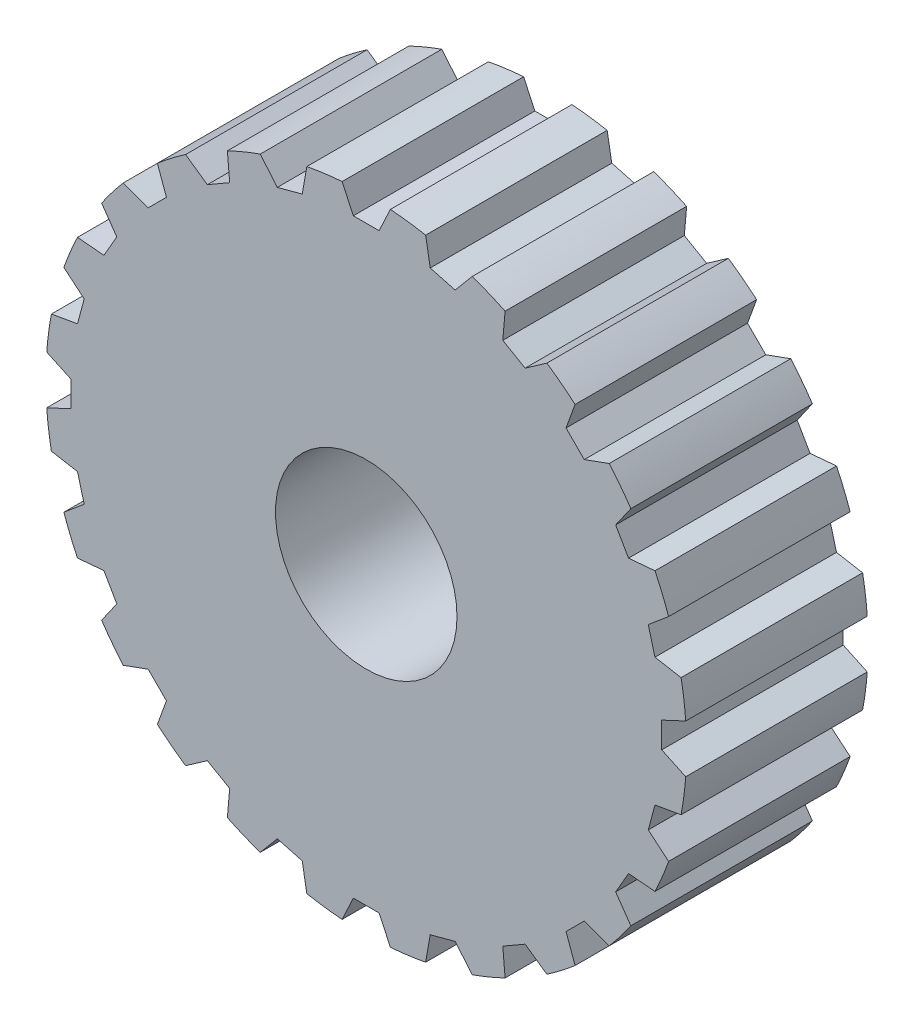
from build123d import *

# Parameters (mm, degrees)
ESQUISSE1_R                  = 14.12
EXTRUSION1_DEPTH             = 8
EXTRUSION2_DEPTH             = 22.511596872
R_P_TITION_CIRCULAIRE1_DEPTH = 8
ESQUISSE3_R                  = 4
EXTRUSION3_DEPTH             = 22.459027804


# Read off the part's stored shape, not the designer's step: Répétition circulaire1
with BuildPart() as part:
    # Esquisse1 → Extrusion1 (new body)
    with BuildSketch(Plane.XY):
        Circle(ESQUISSE1_R)
    extrude(amount=EXTRUSION1_DEPTH)

    # Esquisse2 → Extrusion2 (cut, through all)
    with BuildSketch(Plane.XY.offset(8)):
        Polygon((-0.5685, 13.02), (0.5685, 13.02), (2.149770097, 16.411044667), (-2.149770097, 16.411044667), align=None)
    extrude(amount=-EXTRUSION2_DEPTH, mode=Mode.SUBTRACT)

    # Répétition circulaire1 outline → Répétition circulaire1 (cut)
    with BuildSketch(Plane.XY):
        with BuildLine():
            ThreePointArc((-2.617609549, 13.875248475), (-3.654524917, 13.638872667), (-4.670707871, 13.325122438))
            Line((-4.670707871, 13.325122438), (-3.918952799, 12.429215631))
            Line((-3.918952799, 12.429215631), (-2.820695135, 12.723492885))
            Line((-2.820695135, 12.723492885), (-2.617609549, 13.875248475))
        make_face()
        with BuildLine():
            Line((3.918952799, 12.429215631), (4.670707871, 13.325122438))
            ThreePointArc((4.670707871, 13.325122438), (3.654524917, 13.638872667), (2.617609549, 13.875248475))
            Line((2.617609549, 13.875248475), (2.820695135, 12.723492885))
            Line((2.820695135, 12.723492885), (3.918952799, 12.429215631))
        make_face()
        with BuildLine():
            Line((7.002335442, 10.991400757), (7.960352825, 11.66221175))
            ThreePointArc((7.960352825, 11.66221175), (7.06, 12.228278701), (6.119595228, 12.724973644))
            Line((6.119595228, 12.724973644), (6.017664558, 11.559900757))
            Line((6.017664558, 11.559900757), (7.002335442, 10.991400757))
        make_face()
        with BuildLine():
            Line((9.608520496, 8.804540086), (10.707512889, 9.204540604))
            ThreePointArc((10.707512889, 9.204540604), (9.98434775, 9.98434775), (9.204540604, 10.707512889))
            Line((9.204540604, 10.707512889), (8.804540086, 9.608520496))
            Line((8.804540086, 9.608520496), (9.608520496, 8.804540086))
        make_face()
        with BuildLine():
            Line((11.559900757, 6.017664558), (12.724973644, 6.119595228))
            ThreePointArc((12.724973644, 6.119595228), (12.228278701, 7.06), (11.66221175, 7.960352825))
            Line((11.66221175, 7.960352825), (10.991400757, 7.002335442))
            Line((10.991400757, 7.002335442), (11.559900757, 6.017664558))
        make_face()
        with BuildLine():
            Line((12.723492885, 2.820695135), (13.875248475, 2.617609549))
            ThreePointArc((13.875248475, 2.617609549), (13.638872667, 3.654524917), (13.325122438, 4.670707871))
            Line((13.325122438, 4.670707871), (12.429215631, 3.918952799))
            Line((12.429215631, 3.918952799), (12.723492885, 2.820695135))
        make_face()
        with BuildLine():
            Line((13.02, -0.5685), (14.079948052, -1.062761894))
            ThreePointArc((14.079948052, -1.062761894), (14.12, 0), (14.079948052, 1.062761894))
            Line((14.079948052, 1.062761894), (13.02, 0.5685))
            Line((13.02, 0.5685), (13.02, -0.5685))
        make_face()
        with BuildLine():
            Line((12.429215631, -3.918952799), (13.325122438, -4.670707871))
            ThreePointArc((13.325122438, -4.670707871), (13.638872667, -3.654524917), (13.875248475, -2.617609549))
            Line((13.875248475, -2.617609549), (12.723492885, -2.820695135))
            Line((12.723492885, -2.820695135), (12.429215631, -3.918952799))
        make_face()
        with BuildLine():
            Line((10.991400757, -7.002335442), (11.66221175, -7.960352825))
            ThreePointArc((11.66221175, -7.960352825), (12.228278701, -7.06), (12.724973644, -6.119595228))
            Line((12.724973644, -6.119595228), (11.559900757, -6.017664558))
            Line((11.559900757, -6.017664558), (10.991400757, -7.002335442))
        make_face()
        with BuildLine():
            Line((8.804540086, -9.608520496), (9.204540604, -10.707512889))
            ThreePointArc((9.204540604, -10.707512889), (9.98434775, -9.98434775), (10.707512889, -9.204540604))
            Line((10.707512889, -9.204540604), (9.608520496, -8.804540086))
            Line((9.608520496, -8.804540086), (8.804540086, -9.608520496))
        make_face()
        with BuildLine():
            Line((6.017664558, -11.559900757), (6.119595228, -12.724973644))
            ThreePointArc((6.119595228, -12.724973644), (7.06, -12.228278701), (7.960352825, -11.66221175))
            Line((7.960352825, -11.66221175), (7.002335442, -10.991400757))
            Line((7.002335442, -10.991400757), (6.017664558, -11.559900757))
        make_face()
        with BuildLine():
            Line((2.820695135, -12.723492885), (2.617609549, -13.875248475))
            ThreePointArc((2.617609549, -13.875248475), (3.654524917, -13.638872667), (4.670707871, -13.325122438))
            Line((4.670707871, -13.325122438), (3.918952799, -12.429215631))
            Line((3.918952799, -12.429215631), (2.820695135, -12.723492885))
        make_face()
        with BuildLine():
            Line((-0.5685, -13.02), (-1.062761894, -14.079948052))
            ThreePointArc((-1.062761894, -14.079948052), (0, -14.12), (1.062761894, -14.079948052))
            Line((1.062761894, -14.079948052), (0.5685, -13.02))
            Line((0.5685, -13.02), (-0.5685, -13.02))
        make_face()
        with BuildLine():
            Line((-3.918952799, -12.429215631), (-4.670707871, -13.325122438))
            ThreePointArc((-4.670707871, -13.325122438), (-3.654524917, -13.638872667), (-2.617609549, -13.875248475))
            Line((-2.617609549, -13.875248475), (-2.820695135, -12.723492885))
            Line((-2.820695135, -12.723492885), (-3.918952799, -12.429215631))
        make_face()
        with BuildLine():
            Line((-7.002335442, -10.991400757), (-7.960352825, -11.66221175))
            ThreePointArc((-7.960352825, -11.66221175), (-7.06, -12.228278701), (-6.119595228, -12.724973644))
            Line((-6.119595228, -12.724973644), (-6.017664558, -11.559900757))
            Line((-6.017664558, -11.559900757), (-7.002335442, -10.991400757))
        make_face()
        with BuildLine():
            Line((-9.608520496, -8.804540086), (-10.707512889, -9.204540604))
            ThreePointArc((-10.707512889, -9.204540604), (-9.98434775, -9.98434775), (-9.204540604, -10.707512889))
            Line((-9.204540604, -10.707512889), (-8.804540086, -9.608520496))
            Line((-8.804540086, -9.608520496), (-9.608520496, -8.804540086))
        make_face()
        with BuildLine():
            Line((-11.559900757, -6.017664558), (-12.724973644, -6.119595228))
            ThreePointArc((-12.724973644, -6.119595228), (-12.228278701, -7.06), (-11.66221175, -7.960352825))
            Line((-11.66221175, -7.960352825), (-10.991400757, -7.002335442))
            Line((-10.991400757, -7.002335442), (-11.559900757, -6.017664558))
        make_face()
        with BuildLine():
            Line((-12.723492885, -2.820695135), (-13.875248475, -2.617609549))
            ThreePointArc((-13.875248475, -2.617609549), (-13.638872667, -3.654524917), (-13.325122438, -4.670707871))
            Line((-13.325122438, -4.670707871), (-12.429215631, -3.918952799))
            Line((-12.429215631, -3.918952799), (-12.723492885, -2.820695135))
        make_face()
        with BuildLine():
            Line((-13.02, 0.5685), (-14.079948052, 1.062761894))
            ThreePointArc((-14.079948052, 1.062761894), (-14.12, 0), (-14.079948052, -1.062761894))
            Line((-14.079948052, -1.062761894), (-13.02, -0.5685))
            Line((-13.02, -0.5685), (-13.02, 0.5685))
        make_face()
        with BuildLine():
            Line((-12.429215631, 3.918952799), (-13.325122438, 4.670707871))
            ThreePointArc((-13.325122438, 4.670707871), (-13.638872667, 3.654524917), (-13.875248475, 2.617609549))
            Line((-13.875248475, 2.617609549), (-12.723492885, 2.820695135))
            Line((-12.723492885, 2.820695135), (-12.429215631, 3.918952799))
        make_face()
        with BuildLine():
            Line((-10.991400757, 7.002335442), (-11.66221175, 7.960352825))
            ThreePointArc((-11.66221175, 7.960352825), (-12.228278701, 7.06), (-12.724973644, 6.119595228))
            Line((-12.724973644, 6.119595228), (-11.559900757, 6.017664558))
            Line((-11.559900757, 6.017664558), (-10.991400757, 7.002335442))
        make_face()
        with BuildLine():
            Line((-8.804540086, 9.608520496), (-9.204540604, 10.707512889))
            ThreePointArc((-9.204540604, 10.707512889), (-9.98434775, 9.98434775), (-10.707512889, 9.204540604))
            Line((-10.707512889, 9.204540604), (-9.608520496, 8.804540086))
            Line((-9.608520496, 8.804540086), (-8.804540086, 9.608520496))
        make_face()
        with BuildLine():
            Line((-6.017664558, 11.559900757), (-6.119595228, 12.724973644))
            ThreePointArc((-6.119595228, 12.724973644), (-7.06, 12.228278701), (-7.960352825, 11.66221175))
            Line((-7.960352825, 11.66221175), (-7.002335442, 10.991400757))
            Line((-7.002335442, 10.991400757), (-6.017664558, 11.559900757))
        make_face()
    extrude(amount=R_P_TITION_CIRCULAIRE1_DEPTH, mode=Mode.SUBTRACT)

    # Esquisse3 → Extrusion3 (cut, through all)
    with BuildSketch(Plane.XY.offset(8)):
        Circle(ESQUISSE3_R)
    extrude(amount=-EXTRUSION3_DEPTH, mode=Mode.SUBTRACT)


solid = part.part
